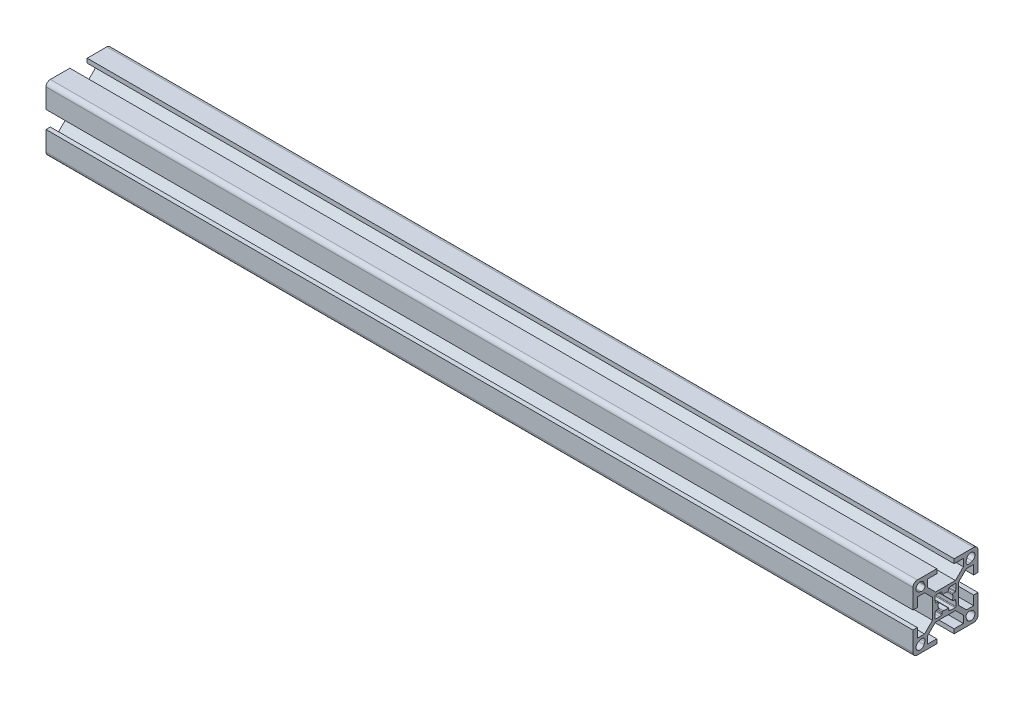
from build123d import *

# Parameters (mm, degrees)
BOSS_EXTRUDE1_DEPTH = 400


with BuildPart() as part:
    # Sketch1 → Boss-Extrude1 (new body)
    with BuildSketch(Plane(origin=(0, 0, 0), x_dir=(0, 0, -1), z_dir=(1, 0, 0))):
        with BuildLine():
            Line((-15, 13), (-15, 4))
            Line((-15, 4), (-13, 4))
            Line((-13, 4), (-13, 8.25))
            Line((-13, 8.25), (-9.664213562, 8.25))
            Line((-9.664213562, 8.25), (-6, 4.585786438))
            Line((-6, 4.585786438), (-6, -4.585786438))
            Line((-6, -4.585786438), (-9.664213562, -8.25))
            Line((-9.664213562, -8.25), (-13, -8.25))
            Line((-13, -8.25), (-13, -4))
            Line((-13, -4), (-15, -4))
            Line((-15, -4), (-15, -13))
            ThreePointArc((-15, -13), (-14.414213562, -14.414213562), (-13, -15))
            Line((-13, -15), (-4, -15))
            Line((-4, -15), (-4, -13))
            Line((-4, -13), (-8.25, -13))
            Line((-8.25, -13), (-8.25, -9.664213562))
            Line((-8.25, -9.664213562), (-4.585786438, -6))
            Line((-4.585786438, -6), (4.585786438, -6))
            Line((4.585786438, -6), (8.25, -9.664213562))
            Line((8.25, -9.664213562), (8.25, -13))
            Line((8.25, -13), (4, -13))
            Line((4, -13), (4, -15))
            Line((4, -15), (13, -15))
            ThreePointArc((13, -15), (14.414213562, -14.414213562), (15, -13))
            Line((15, -13), (15, -4))
            Line((15, -4), (13, -4))
            Line((13, -4), (13, -8.25))
            Line((13, -8.25), (9.664213562, -8.25))
            Line((9.664213562, -8.25), (6, -4.585786438))
            Line((6, -4.585786438), (6, 4.585786438))
            Line((6, 4.585786438), (9.664213562, 8.25))
            Line((9.664213562, 8.25), (13, 8.25))
            Line((13, 8.25), (13, 4))
            Line((13, 4), (15, 4))
            Line((15, 4), (15, 13))
            ThreePointArc((15, 13), (14.414213562, 14.414213562), (13, 15))
            Line((13, 15), (4, 15))
            Line((4, 15), (4, 13))
            Line((4, 13), (8.25, 13))
            Line((8.25, 13), (8.25, 9.664213562))
            Line((8.25, 9.664213562), (4.585786438, 6))
            Line((4.585786438, 6), (-4.585786438, 6))
            Line((-4.585786438, 6), (-8.25, 9.664213562))
            Line((-8.25, 9.664213562), (-8.25, 13))
            Line((-8.25, 13), (-4, 13))
            Line((-4, 13), (-4, 15))
            Line((-4, 15), (-13, 15))
            ThreePointArc((-13, 15), (-14.414213562, 14.414213562), (-15, 13))
        make_face()
        with BuildLine():
            Line((-9.539070071, 11.338915743), (-9.918883282, 12.361530981))
            ThreePointArc((-9.918883282, 12.361530981), (-13.043502884, 13.043502884), (-12.361530981, 9.918883282))
            Line((-12.361530981, 9.918883282), (-11.338915743, 9.539070071))
            ThreePointArc((-11.338915743, 9.539070071), (-9.861522369, 9.861522369), (-9.539070071, 11.338915743))
        make_face(mode=Mode.SUBTRACT)
        with BuildLine():
            Line((9.918883282, 12.361530981), (9.539070071, 11.338915743))
            ThreePointArc((9.539070071, 11.338915743), (9.861522369, 9.861522369), (11.338915743, 9.539070071))
            Line((11.338915743, 9.539070071), (12.361530981, 9.918883282))
            ThreePointArc((12.361530981, 9.918883282), (13.043502884, 13.043502884), (9.918883282, 12.361530981))
        make_face(mode=Mode.SUBTRACT)
        with BuildLine():
            Line((12.361530981, -9.918883282), (11.338915743, -9.539070071))
            ThreePointArc((11.338915743, -9.539070071), (9.861522369, -9.861522369), (9.539070071, -11.338915743))
            Line((9.539070071, -11.338915743), (9.918883282, -12.361530981))
            ThreePointArc((9.918883282, -12.361530981), (13.043502884, -13.043502884), (12.361530981, -9.918883282))
        make_face(mode=Mode.SUBTRACT)
        with BuildLine():
            Line((-11.338915743, -9.539070071), (-12.361530981, -9.918883282))
            ThreePointArc((-12.361530981, -9.918883282), (-13.043502884, -13.043502884), (-9.918883282, -12.361530981))
            Line((-9.918883282, -12.361530981), (-9.539070071, -11.338915743))
            ThreePointArc((-9.539070071, -11.338915743), (-9.861522369, -9.861522369), (-11.338915743, -9.539070071))
        make_face(mode=Mode.SUBTRACT)
        with BuildLine():
            Line((-4.8, -2.644433572), (-4.8, -4.5))
            ThreePointArc((-4.8, -4.5), (-4.712132034, -4.712132034), (-4.5, -4.8))
            Line((-4.5, -4.8), (-2.644433572, -4.8))
            ThreePointArc((-2.644433572, -4.8), (-2.615679847, -4.79861886), (-2.587190874, -4.794488155))
            Line((-2.587190874, -4.794488155), (-1.742757301, -4.630346896))
            ThreePointArc((-1.742757301, -4.630346896), (-1.568512625, -4.526682207), (-1.5, -4.335858741))
            Line((-1.5, -4.335858741), (-1.5, -3.5))
            ThreePointArc((-1.5, -3.5), (-1.374371458, -3.255879959), (-1.102702703, -3.216216216))
            ThreePointArc((-1.102702703, -3.216216216), (0, -3.4), (1.102702703, -3.216216216))
            ThreePointArc((1.102702703, -3.216216216), (1.374371458, -3.255879959), (1.5, -3.5))
            Line((1.5, -3.5), (1.5, -4.335858741))
            ThreePointArc((1.5, -4.335858741), (1.568512625, -4.526682207), (1.742757301, -4.630346896))
            Line((1.742757301, -4.630346896), (2.587190874, -4.794488155))
            ThreePointArc((2.587190874, -4.794488155), (2.615679847, -4.79861886), (2.644433572, -4.8))
            Line((2.644433572, -4.8), (4.5, -4.8))
            ThreePointArc((4.5, -4.8), (4.712132034, -4.712132034), (4.8, -4.5))
            Line((4.8, -4.5), (4.8, -2.644433572))
            ThreePointArc((4.8, -2.644433572), (4.79861886, -2.615679847), (4.794488155, -2.587190874))
            Line((4.794488155, -2.587190874), (4.630346896, -1.742757301))
            ThreePointArc((4.630346896, -1.742757301), (4.526682207, -1.568512625), (4.335858741, -1.5))
            Line((4.335858741, -1.5), (3.5, -1.5))
            ThreePointArc((3.5, -1.5), (3.255879959, -1.374371458), (3.216216216, -1.102702703))
            ThreePointArc((3.216216216, -1.102702703), (3.4, 0), (3.216216216, 1.102702703))
            ThreePointArc((3.216216216, 1.102702703), (3.255879959, 1.374371458), (3.5, 1.5))
            Line((3.5, 1.5), (4.335858741, 1.5))
            ThreePointArc((4.335858741, 1.5), (4.526682207, 1.568512625), (4.630346896, 1.742757301))
            Line((4.630346896, 1.742757301), (4.794488155, 2.587190874))
            ThreePointArc((4.794488155, 2.587190874), (4.79861886, 2.615679847), (4.8, 2.644433572))
            Line((4.8, 2.644433572), (4.8, 4.5))
            ThreePointArc((4.8, 4.5), (4.712132034, 4.712132034), (4.5, 4.8))
            Line((4.5, 4.8), (2.644433572, 4.8))
            ThreePointArc((2.644433572, 4.8), (2.615679847, 4.79861886), (2.587190874, 4.794488155))
            Line((2.587190874, 4.794488155), (1.742757301, 4.630346896))
            ThreePointArc((1.742757301, 4.630346896), (1.568512625, 4.526682207), (1.5, 4.335858741))
            Line((1.5, 4.335858741), (1.5, 3.5))
            ThreePointArc((1.5, 3.5), (1.374371458, 3.255879959), (1.102702703, 3.216216216))
            ThreePointArc((1.102702703, 3.216216216), (0, 3.4), (-1.102702703, 3.216216216))
            ThreePointArc((-1.102702703, 3.216216216), (-1.374371458, 3.255879959), (-1.5, 3.5))
            Line((-1.5, 3.5), (-1.5, 4.335858741))
            ThreePointArc((-1.5, 4.335858741), (-1.568512625, 4.526682207), (-1.742757301, 4.630346896))
            Line((-1.742757301, 4.630346896), (-2.587190874, 4.794488155))
            ThreePointArc((-2.587190874, 4.794488155), (-2.615679847, 4.79861886), (-2.644433572, 4.8))
            Line((-2.644433572, 4.8), (-4.5, 4.8))
            ThreePointArc((-4.5, 4.8), (-4.712132034, 4.712132034), (-4.8, 4.5))
            Line((-4.8, 4.5), (-4.8, 2.644433572))
            ThreePointArc((-4.8, 2.644433572), (-4.79861886, 2.615679847), (-4.794488155, 2.587190874))
            Line((-4.794488155, 2.587190874), (-4.630346896, 1.742757301))
            ThreePointArc((-4.630346896, 1.742757301), (-4.526682207, 1.568512625), (-4.335858741, 1.5))
            Line((-4.335858741, 1.5), (-3.5, 1.5))
            ThreePointArc((-3.5, 1.5), (-3.255879959, 1.374371458), (-3.216216216, 1.102702703))
            ThreePointArc((-3.216216216, 1.102702703), (-3.4, 0), (-3.216216216, -1.102702703))
            ThreePointArc((-3.216216216, -1.102702703), (-3.255879959, -1.374371458), (-3.5, -1.5))
            Line((-3.5, -1.5), (-4.335858741, -1.5))
            ThreePointArc((-4.335858741, -1.5), (-4.526682207, -1.568512625), (-4.630346896, -1.742757301))
            Line((-4.630346896, -1.742757301), (-4.794488155, -2.587190874))
            ThreePointArc((-4.794488155, -2.587190874), (-4.79861886, -2.615679847), (-4.8, -2.644433572))
        make_face(mode=Mode.SUBTRACT)
    extrude(amount=BOSS_EXTRUDE1_DEPTH)


solid = part.part
